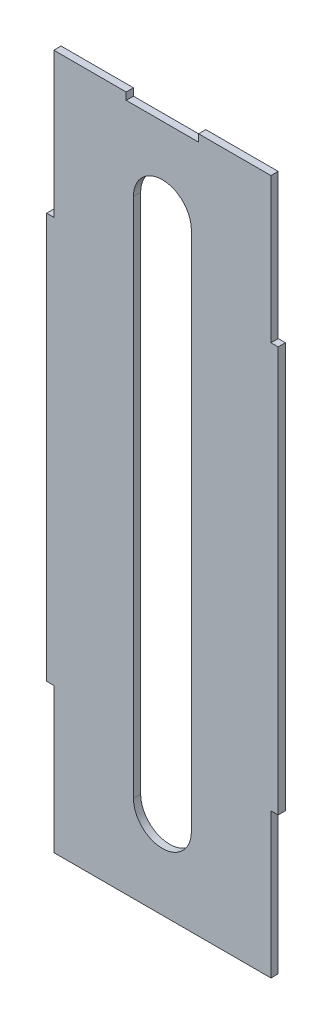
from build123d import *

# Parameters (mm, degrees)
SKETCH2_W                = 215.9
SKETCH2_H                = 609.6
BOSS_EXTRUDE1_DEPTH      = 6.35
CUT_EXTRUDE1_DEPTH       = 1223.317197994
CUT_EXTRUDE2_DEPTH       = 1223.317197994
CUT_EXTRUDE2_DEPTH_BACK  = 1223.317197994
CUT_EXTRUDE3_DEPTH       = 1223.317197994
CUT_EXTRUDE3_DEPTH_BACK  = 1223.317197994
CUT_EXTRUDE6_DEPTH       = 1223.317197994
CUT_EXTRUDE6_DEPTH_BACK  = 1223.317197994
CUT_EXTRUDE7_DEPTH       = 1223.317197994
CUT_EXTRUDE7_DEPTH_BACK  = 1223.317197994
CUT_EXTRUDE11_DEPTH      = 1223.317197994
CUT_EXTRUDE11_DEPTH_BACK = 1223.317197994
CUT_EXTRUDE13_DEPTH      = 1218.028093376
CUT_EXTRUDE13_DEPTH_BACK = 1218.028093376
CUT_EXTRUDE14_DEPTH      = 1218.028093376
CUT_EXTRUDE14_DEPTH_BACK = 1218.028093376


with BuildPart() as part:
    # Sketch2 → Boss-Extrude1 (new body)
    with BuildSketch(Plane.XY):
        with Locations((-911.126767395, 370.108550968)):
            Rectangle(SKETCH2_W, SKETCH2_H)
    extrude(amount=BOSS_EXTRUDE1_DEPTH)

    # Sketch3 → Cut-Extrude1 (cut, through all)
    with BuildSketch(Plane.XY.offset(6.35)):
        with BuildLine():
            Line((-936.526767395, 141.508550968), (-936.526767395, 598.708550968))
            ThreePointArc((-936.526767395, 598.708550968), (-911.126767395, 624.108550968), (-885.726767395, 598.708550968))
            Line((-885.726767395, 598.708550968), (-885.726767395, 141.508550968))
            ThreePointArc((-885.726767395, 141.508550968), (-911.126767395, 116.108550968), (-936.526767395, 141.508550968))
        make_face()
    extrude(amount=-CUT_EXTRUDE1_DEPTH, mode=Mode.SUBTRACT)

    # Sketch4 → Cut-Extrude2 (cut, two sides: drawn at the far end of the back side and taken through both)
    with BuildSketch(Plane.XY.offset(6.35).offset(-CUT_EXTRUDE2_DEPTH_BACK)):
        Polygon((-815.876767395, 1970.05819206), (-815.876767395, 674.908550968), (-815.876767395, 547.908550968), (-803.176767395, 547.908550968), (491.972873698, 547.908550968), (2398.607136056, 2301.304159748), (1090.757494964, 3723.45380084), align=None)
    extrude(amount=CUT_EXTRUDE2_DEPTH + CUT_EXTRUDE2_DEPTH_BACK, mode=Mode.SUBTRACT)

    # Sketch5 → Cut-Extrude3 (cut, two sides: drawn at the far end of the back side and taken through both)
    with BuildSketch(Plane.XY.offset(6.35).offset(-CUT_EXTRUDE3_DEPTH_BACK)):
        Polygon((-815.876767395, -1229.841090125), (-815.876767395, 65.308550968), (-815.876767395, 192.308550968), (-803.176767395, 192.308550968), (491.972873698, 192.308550968), (2398.607136056, -1561.087057812), (1090.757494964, -2983.236698905), align=None)
    extrude(amount=CUT_EXTRUDE3_DEPTH + CUT_EXTRUDE3_DEPTH_BACK, mode=Mode.SUBTRACT)

    # Sketch6 → Cut-Extrude6 (cut, two sides: drawn at the far end of the back side and taken through both)
    with BuildSketch(Plane.XY.offset(6.35).offset(-CUT_EXTRUDE6_DEPTH_BACK)):
        Polygon((-1006.376767395, 1970.05819206), (-1006.376767395, 674.908550968), (-1006.376767395, 547.908550968), (-1019.076767395, 547.908550968), (-2314.226408487, 547.908550968), (-4220.860670845, 2301.304159748), (-2913.011029753, 3723.45380084), align=None)
    extrude(amount=CUT_EXTRUDE6_DEPTH + CUT_EXTRUDE6_DEPTH_BACK, mode=Mode.SUBTRACT)

    # Sketch9 → Cut-Extrude7 (cut, two sides: drawn at the far end of the back side and taken through both)
    with BuildSketch(Plane.XY.offset(6.35).offset(-CUT_EXTRUDE7_DEPTH_BACK)):
        Polygon((-1006.376767395, -1229.841090125), (-1006.376767395, 65.308550968), (-1006.376767395, 192.308550968), (-1019.076767395, 192.308550968), (-2314.226408487, 192.308550968), (-4220.860670845, -1561.087057812), (-2913.011029753, -2983.236698905), align=None)
    extrude(amount=CUT_EXTRUDE7_DEPTH + CUT_EXTRUDE7_DEPTH_BACK, mode=Mode.SUBTRACT)

    # Sketch16 → Cut-Extrude11 (cut, two sides: drawn at the far end of the back side and taken through both)
    with BuildSketch(Plane.XY.offset(6.35).offset(-CUT_EXTRUDE11_DEPTH_BACK)):
        Polygon((-1012.726767395, -869.953702465), (-1012.726767395, 192.308550968), (-1012.726767395, 547.908550968), (-1012.726767395, 1610.170804401), (-3137.251274261, 1610.170804401), (-3137.251274261, -869.953702465), align=None)
    extrude(amount=CUT_EXTRUDE11_DEPTH + CUT_EXTRUDE11_DEPTH_BACK, mode=Mode.SUBTRACT)

    # Sketch17 → Cut-Extrude13 (cut, two sides: drawn at the far end of the back side and taken through both)
    with BuildSketch(Plane.XY.offset(6.35).offset(-CUT_EXTRUDE13_DEPTH_BACK)):
        Polygon((-809.526767395, -864.960277939), (-809.526767395, 192.308550968), (-809.526767395, 547.908550968), (-809.526767395, 1605.177379875), (1305.010890419, 1605.177379875), (1305.010890419, -864.960277939), align=None)
    extrude(amount=CUT_EXTRUDE13_DEPTH + CUT_EXTRUDE13_DEPTH_BACK, mode=Mode.SUBTRACT)

    # Sketch13 → Cut-Extrude14 (cut, two sides: drawn at the far end of the back side and taken through both)
    with BuildSketch(Plane(origin=(0, 0, 0), x_dir=(-1, 0, 0), z_dir=(0, 0, -1)).offset(-CUT_EXTRUDE14_DEPTH_BACK)):
        Polygon((942.876767395, 1932.938009755), (942.876767395, 674.908550968), (942.876767395, 668.558550968), (879.376767395, 668.558550968), (879.376767395, 674.908550968), (879.376767395, 1932.938009755), (879.376767395, 4448.996927328), (942.876767395, 4448.996927328), align=None)
    extrude(amount=CUT_EXTRUDE14_DEPTH + CUT_EXTRUDE14_DEPTH_BACK, mode=Mode.SUBTRACT)


solid = part.part
